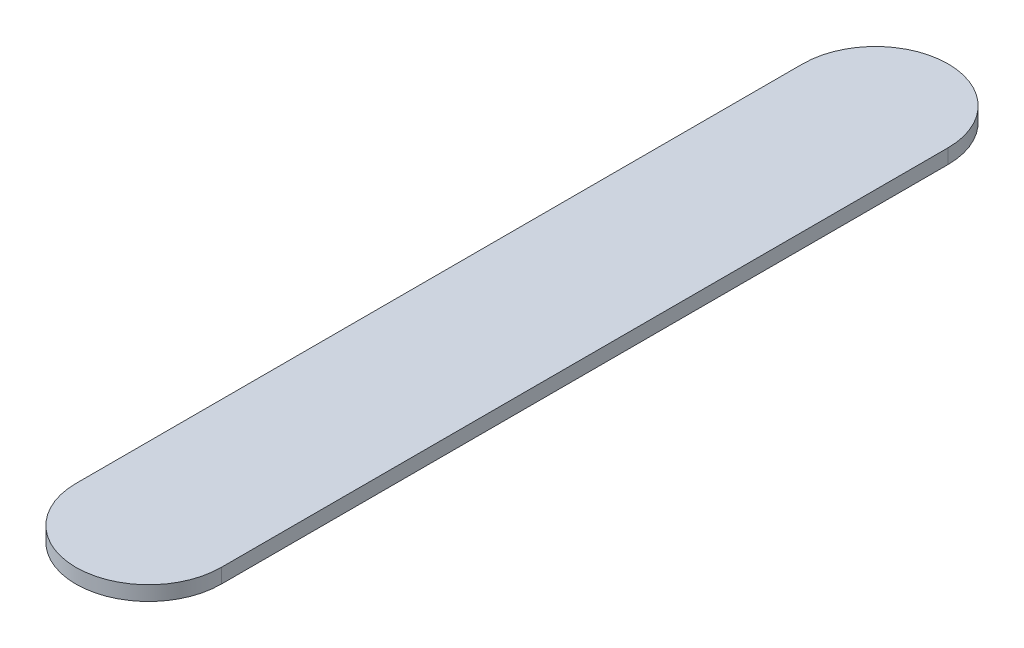
from build123d import *

# Parameters (mm, degrees)
BOSS_EXTRUDE1_DEPTH = 1


with BuildPart() as part:
    # Sketch1 → Boss-Extrude1 (new body)
    with BuildSketch(Plane(origin=(0, 0, 0), x_dir=(1, 0, 0), z_dir=(0, 1, 0))):
        with BuildLine():
            Line((0, 0), (0, 50))
            ThreePointArc((0, 50), (5, 55), (10, 50))
            Line((10, 50), (10, 0))
            ThreePointArc((10, 0), (5, -5), (0, 0))
        make_face()
    extrude(amount=BOSS_EXTRUDE1_DEPTH)


solid = part.part
